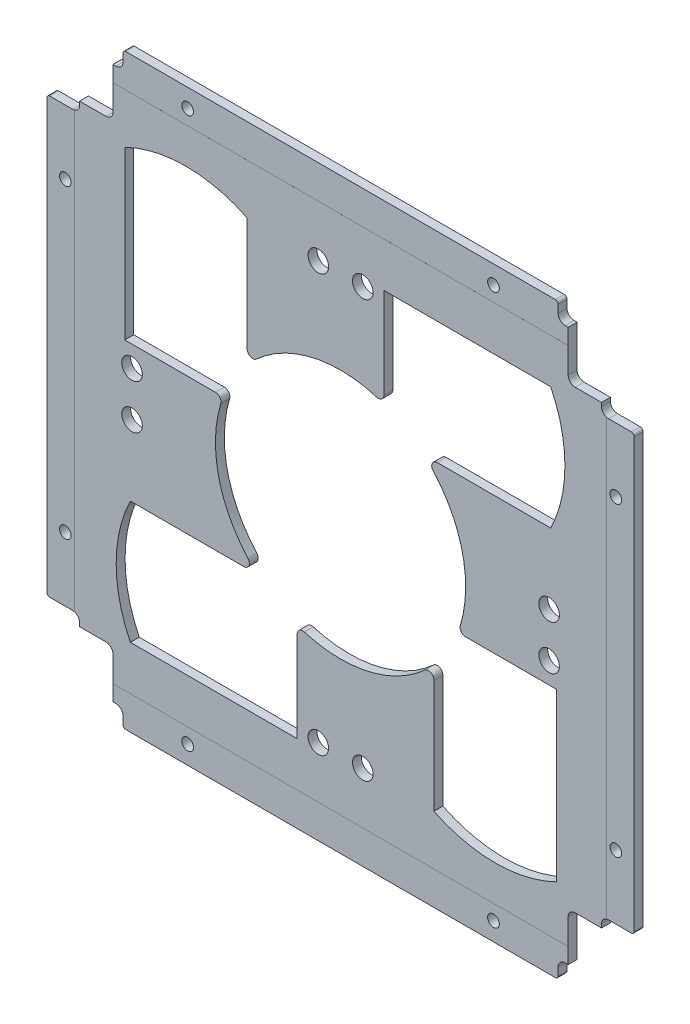
from build123d import *

# Parameters (mm, degrees)
SKETCH1_W                 = 106
SKETCH1_H                 = 106
MAINOUTLINE_DEPTH         = 1.6
SKETCH4_W                 = 11.7
SKETCH4_H                 = 11.7
RAILCUTOUTS_DEPTH         = 75.970394157
SKETCH13_W                = 5.7
SKETCH13_H                = 1.9
SKETCH13_W_2              = 1.8
SKETCH13_H_2              = 3
FILLETCUTOUTS_DEPTH       = 75.970394157
SMOOTHCORNER_DEPTH        = 10
MIRROR2_COPY_1_SKETCH_W   = 11.7
MIRROR2_COPY_1_SKETCH_H   = 11.7
MIRROR2_COPY_1_DEPTH      = 75.970394157
MIRROR2_COPY_2_SKETCH_W   = 5.7
MIRROR2_COPY_2_SKETCH_H   = 1.9
MIRROR2_COPY_2_SKETCH_W_2 = 1.8
MIRROR2_COPY_2_SKETCH_H_2 = 3
MIRROR2_COPY_2_DEPTH      = 75.970394157
MIRROR2_COPY_3_DEPTH      = 10
MIRROR2_COPY_4_SKETCH_W   = 11.7
MIRROR2_COPY_4_SKETCH_H   = 11.7
MIRROR2_COPY_4_DEPTH      = 75.970394157
MIRROR2_COPY_5_SKETCH_W   = 5.7
MIRROR2_COPY_5_SKETCH_H   = 1.9
MIRROR2_COPY_5_SKETCH_W_2 = 1.8
MIRROR2_COPY_5_SKETCH_H_2 = 3
MIRROR2_COPY_5_DEPTH      = 75.970394157
MIRROR2_COPY_6_DEPTH      = 10
M2_CLEARANCE_HOLE1_D      = 2.1
SKETCH16_W                = 90
SKETCH16_H                = 6.2
SKETCH16_W_2              = 5.2
SKETCH16_H_2              = 90
CUT_EXTRUDE6_DEPTH        = 0.001
CUT_EXTRUDE10_DEPTH       = 75.970394157
CUT_EXTRUDE10_DEPTH_BACK  = 75.970394157
SKETCH21_R                = 22.5
SKETCH24_OUTSIDE_W        = 137.984
SKETCH24_OUTSIDE_H        = 137.984
SKETCH24_OUTSIDE_W_2      = 105.6
SKETCH24_OUTSIDE_H_2      = 105.6
CUT_EXTRUDE19_DEPTH       = 75.970394157
FILLET7_R                 = 0.5
F_1_0MM_DOWEL_HOLE1_D     = 3.7
CUT_EXTRUDE23_DEPTH       = 75.687616109
FILLET14_R                = 1


with BuildPart() as part:
    # Sketch1 → mainOutline (new body)
    with BuildSketch(Plane.XY):
        Rectangle(SKETCH1_W, SKETCH1_H)
    extrude(amount=MAINOUTLINE_DEPTH)

    # Sketch4 → railCutouts (cut, through all)
    with BuildSketch(Plane(origin=(0, 0, 0), x_dir=(-1, 0, 0), z_dir=(0, 0, -1))):
        with Locations((47.15, 47.15)):
            Rectangle(SKETCH4_W, SKETCH4_H)
    railcutouts = extrude(amount=-RAILCUTOUTS_DEPTH, mode=Mode.SUBTRACT)

    # Sketch13 → filletCutouts (cut, symmetric)
    with BuildSketch(Plane(origin=(0, 0, 0), x_dir=(-1, 0, 0), z_dir=(0, 0, -1))):
        with Locations((50.15, 40.35)):
            Rectangle(SKETCH13_W, SKETCH13_H)
        with Locations((40.4, 51.5)):
            Rectangle(SKETCH13_W_2, SKETCH13_H_2)
    filletcutouts = extrude(amount=FILLETCUTOUTS_DEPTH, both=True, mode=Mode.SUBTRACT)

    # Sketch27 → smoothCorner (cut)
    with BuildSketch(Plane.XY.offset(1.6)):
        with BuildLine():
            Line((-40.928025612, 42.198025612), (-40.928025612, 49.628025612))
            Line((-40.928025612, 49.628025612), (-40.398025612, 49.628025612))
            ThreePointArc((-40.398025612, 49.628025612), (-39.5, 50), (-39.128025612, 50.898025612))
            Line((-39.128025612, 50.898025612), (-39.128025612, 53))
            Line((-39.128025612, 53), (-53, 53))
            Line((-53, 53), (-53, 39.028025612))
            Line((-53, 39.028025612), (-48.198025612, 39.028025612))
            ThreePointArc((-48.198025612, 39.028025612), (-47.3, 39.4), (-46.928025612, 40.298025612))
            Line((-46.928025612, 40.298025612), (-46.928025612, 40.928025612))
            Line((-46.928025612, 40.928025612), (-42.198025612, 40.928025612))
            ThreePointArc((-42.198025612, 40.928025612), (-41.3, 41.3), (-40.928025612, 42.198025612))
        make_face()
    smoothcorner = extrude(amount=-SMOOTHCORNER_DEPTH, mode=Mode.SUBTRACT)

    # Mirror1: railCutouts, filletCutouts, smoothCorner across plane
    add(railcutouts.mirror(Plane(origin=(0, 0, 0), x_dir=(0, 0, 1), z_dir=(1, 0, 0))), mode=Mode.SUBTRACT)
    add(filletcutouts.mirror(Plane(origin=(0, 0, 0), x_dir=(0, 0, 1), z_dir=(1, 0, 0))), mode=Mode.SUBTRACT)
    add(smoothcorner.mirror(Plane(origin=(0, 0, 0), x_dir=(0, 0, 1), z_dir=(1, 0, 0))), mode=Mode.SUBTRACT)

    # Mirror2 copy 1 sketch → Mirror2 copy 1 (cut, through all)
    with BuildSketch(Plane(origin=(0, 0, 0), x_dir=(1, 0, 0), z_dir=(0, 0, -1))):
        with Locations((47.15, 47.15)):
            Rectangle(MIRROR2_COPY_1_SKETCH_W, MIRROR2_COPY_1_SKETCH_H)
    extrude(amount=-MIRROR2_COPY_1_DEPTH, mode=Mode.SUBTRACT)

    # Mirror2 copy 2 sketch → Mirror2 copy 2 (cut, symmetric)
    with BuildSketch(Plane(origin=(0, 0, 0), x_dir=(1, 0, 0), z_dir=(0, 0, -1))):
        with Locations((50.15, 40.35)):
            Rectangle(MIRROR2_COPY_2_SKETCH_W, MIRROR2_COPY_2_SKETCH_H)
        with Locations((40.4, 51.5)):
            Rectangle(MIRROR2_COPY_2_SKETCH_W_2, MIRROR2_COPY_2_SKETCH_H_2)
    extrude(amount=MIRROR2_COPY_2_DEPTH, both=True, mode=Mode.SUBTRACT)

    # Mirror2 copy 3 sketch → Mirror2 copy 3 (cut)
    with BuildSketch(Plane(origin=(0, 0, 1.6), x_dir=(-1, 0, 0), z_dir=(0, 0, 1))):
        with BuildLine():
            Line((-40.928025612, 42.198025612), (-40.928025612, 49.628025612))
            Line((-40.928025612, 49.628025612), (-40.398025612, 49.628025612))
            ThreePointArc((-40.398025612, 49.628025612), (-39.5, 50), (-39.128025612, 50.898025612))
            Line((-39.128025612, 50.898025612), (-39.128025612, 53))
            Line((-39.128025612, 53), (-53, 53))
            Line((-53, 53), (-53, 39.028025612))
            Line((-53, 39.028025612), (-48.198025612, 39.028025612))
            ThreePointArc((-48.198025612, 39.028025612), (-47.3, 39.4), (-46.928025612, 40.298025612))
            Line((-46.928025612, 40.298025612), (-46.928025612, 40.928025612))
            Line((-46.928025612, 40.928025612), (-42.198025612, 40.928025612))
            ThreePointArc((-42.198025612, 40.928025612), (-41.3, 41.3), (-40.928025612, 42.198025612))
        make_face()
    extrude(amount=-MIRROR2_COPY_3_DEPTH, mode=Mode.SUBTRACT)

    # Mirror2 copy 4 sketch → Mirror2 copy 4 (cut, through all)
    with BuildSketch(Plane(origin=(0, 0, 0), x_dir=(-1, 0, 0), z_dir=(0, 0, -1))):
        with Locations((47.15, -47.15)):
            Rectangle(MIRROR2_COPY_4_SKETCH_W, MIRROR2_COPY_4_SKETCH_H)
    extrude(amount=-MIRROR2_COPY_4_DEPTH, mode=Mode.SUBTRACT)

    # Mirror2 copy 5 sketch → Mirror2 copy 5 (cut, symmetric)
    with BuildSketch(Plane(origin=(0, 0, 0), x_dir=(-1, 0, 0), z_dir=(0, 0, -1))):
        with Locations((50.15, -40.35)):
            Rectangle(MIRROR2_COPY_5_SKETCH_W, MIRROR2_COPY_5_SKETCH_H)
        with Locations((40.4, -51.5)):
            Rectangle(MIRROR2_COPY_5_SKETCH_W_2, MIRROR2_COPY_5_SKETCH_H_2)
    extrude(amount=MIRROR2_COPY_5_DEPTH, both=True, mode=Mode.SUBTRACT)

    # Mirror2 copy 6 sketch → Mirror2 copy 6 (cut)
    with BuildSketch(Plane.XY.offset(1.6)):
        with BuildLine():
            Line((-40.928025612, -42.198025612), (-40.928025612, -49.628025612))
            Line((-40.928025612, -49.628025612), (-40.398025612, -49.628025612))
            ThreePointArc((-40.398025612, -49.628025612), (-39.5, -50), (-39.128025612, -50.898025612))
            Line((-39.128025612, -50.898025612), (-39.128025612, -53))
            Line((-39.128025612, -53), (-53, -53))
            Line((-53, -53), (-53, -39.028025612))
            Line((-53, -39.028025612), (-48.198025612, -39.028025612))
            ThreePointArc((-48.198025612, -39.028025612), (-47.3, -39.4), (-46.928025612, -40.298025612))
            Line((-46.928025612, -40.298025612), (-46.928025612, -40.928025612))
            Line((-46.928025612, -40.928025612), (-42.198025612, -40.928025612))
            ThreePointArc((-42.198025612, -40.928025612), (-41.3, -41.3), (-40.928025612, -42.198025612))
        make_face()
    extrude(amount=-MIRROR2_COPY_6_DEPTH, mode=Mode.SUBTRACT)

    # M2 Clearance Hole1 (through all)
    with Locations(Plane(origin=(0, 0, 0), x_dir=(-1, 0, 0), z_dir=(0, 0, -1))):
        with Locations((49.5, -27.5), (27.5, -49.5), (-49.5, -27.5), (-27.5, -49.5), (-27.5, 49.5), (-49.5, 27.5), (27.5, 49.5), (49.5, 27.5)):
            Hole(M2_CLEARANCE_HOLE1_D / 2)

    # Sketch16 → Cut-Extrude6 (cut)
    with BuildSketch(Plane.XY.offset(1.6)):
        with Locations((0, -49.9)):
            Rectangle(SKETCH16_W, SKETCH16_H)
        with Locations((0, 49.9)):
            Rectangle(SKETCH16_W, SKETCH16_H)
        with Locations((-50.4, 0)):
            Rectangle(SKETCH16_W_2, SKETCH16_H_2)
        with Locations((50.4, 0)):
            Rectangle(SKETCH16_W_2, SKETCH16_H_2)
    extrude(amount=-CUT_EXTRUDE6_DEPTH, mode=Mode.SUBTRACT)

    # Sketch21 → Cut-Extrude10 (cut, two sides: drawn at the far end of the back side and taken through both)
    with BuildSketch(Plane.XY.offset(-CUT_EXTRUDE10_DEPTH_BACK)):
        Circle(SKETCH21_R)
    extrude(amount=CUT_EXTRUDE10_DEPTH + CUT_EXTRUDE10_DEPTH_BACK, mode=Mode.SUBTRACT)

    # Sketch24 outside → Cut-Extrude19 (cut, through all)
    with BuildSketch(Plane.XY.offset(1.6)):
        Rectangle(SKETCH24_OUTSIDE_W, SKETCH24_OUTSIDE_H)
        Rectangle(SKETCH24_OUTSIDE_W_2, SKETCH24_OUTSIDE_H_2, mode=Mode.SUBTRACT)
    extrude(amount=-CUT_EXTRUDE19_DEPTH, mode=Mode.SUBTRACT)

    # Fillet7
    fillet7_edges = [part.edges().sort_by_distance(p)[0] for p in [
        (-52.8, -39.028025612, 0.7995),
        (-39.128025612, -52.8, 0.7995),
        (39.128025612, -52.8, 0.7995),
        (52.8, -39.028025612, 0.7995),
        (52.8, 39.028025612, 0.7995),
        (39.128025612, 52.8, 0.7995),
        (-39.128025612, 52.8, 0.7995),
        (-52.8, 39.028025612, 0.7995),
    ]]
    fillet(fillet7_edges, radius=FILLET7_R)

    # Ø1.0mm Dowel Hole1 (through all)
    with Locations(Plane(origin=(-37.5, 4, 0), x_dir=(-1, 0, 0), z_dir=(0, 0, -1))):
        with Locations((0, 0), (0, -8), (-33.5, -41.5), (-41.5, -41.5), (-75, -8), (-75, 0), (-41.5, 33.5), (-33.5, 33.5)):
            Hole(F_1_0MM_DOWEL_HOLE1_D / 2)

    # Sketch33 → Cut-Extrude23 (cut, through all)
    with BuildSketch(Plane(origin=(0, 0, 0), x_dir=(-1, 0, 0), z_dir=(0, 0, -1))):
        with BuildLine():
            Line((-7.8, 16.8), (-7.8, 38.8))
            Line((-7.8, 38.8), (-37.8, 38.8))
            ThreePointArc((-37.8, 38.8), (-40.350055679, 27.8), (-37.8, 16.8))
            Line((-37.8, 16.8), (-7.8, 16.8))
        make_face()
        with BuildLine():
            Line((-16.8, -7.8), (-38.8, -7.8))
            Line((-38.8, -7.8), (-38.8, -37.8))
            ThreePointArc((-38.8, -37.8), (-27.8, -40.350055679), (-16.8, -37.8))
            Line((-16.8, -37.8), (-16.8, -7.8))
        make_face()
        with BuildLine():
            Line((16.8, 7.8), (38.8, 7.8))
            Line((38.8, 7.8), (38.8, 37.8))
            ThreePointArc((38.8, 37.8), (27.8, 40.350055679), (16.8, 37.8))
            Line((16.8, 37.8), (16.8, 7.8))
        make_face()
        with BuildLine():
            Line((7.8, -16.8), (7.8, -38.8))
            Line((7.8, -38.8), (37.8, -38.8))
            ThreePointArc((37.8, -38.8), (40.350055679, -27.8), (37.8, -16.8))
            Line((37.8, -16.8), (7.8, -16.8))
        make_face()
    extrude(amount=-CUT_EXTRUDE23_DEPTH, mode=Mode.SUBTRACT)

    # Fillet14
    fillet14_edges = [part.edges().sort_by_distance(p)[0] for p in [
        (7.8, 21.104738804, 0.8),
        (14.96696362, 16.8, 0.8),
        (21.104738804, -7.8, 0.8),
        (16.8, -14.96696362, 0.8),
        (-16.8, 14.96696362, 0.8),
        (-21.104738804, 7.8, 0.8),
        (-7.8, -21.104738804, 0.8),
        (-14.96696362, -16.8, 0.8),
    ]]
    fillet(fillet14_edges, radius=FILLET14_R)


solid = part.part
